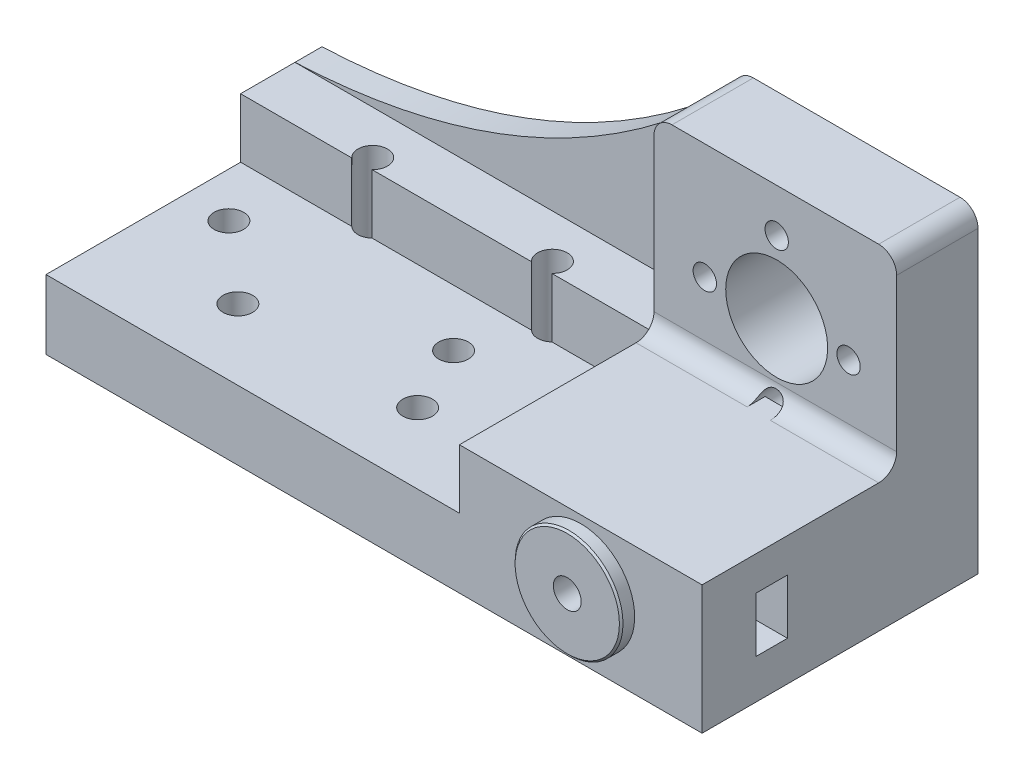
from build123d import *
from build123d.topology import SkipClean

# Parameters (mm, degrees)
CROQUIS2_R                  = 10.875
CROQUIS2_R_2                = 5.67
CROQUIS2_R_3                = 1.6
CROQUIS2_R_4                = 1.3
SALIENTE_EXTRUIR1_DEPTH     = 30.7
CROQUIS4_W                  = 27
CROQUIS4_H                  = 26
CORTAR_EXTRUIR2_DEPTH       = 22.7
CORTAR_EXTRUIR5_DEPTH       = 43
CROQUIS5_R                  = 1.65
CORTAR_EXTRUIR6_DEPTH       = 87.297233443
CORTAR_EXTRUIR7_REACH       = 88.297
CROQUIS7_W                  = 48
CROQUIS7_H                  = 15.35
CORTAR_EXTRUIR21_DEPTH      = 32.6
CORTAR_EXTRUIR9_DEPTH       = 3
CORTAR_EXTRUIR9_DEPTH_BACK  = 80.795378939
CORTAR_EXTRUIR10_DEPTH      = 80.795378939
CORTAR_EXTRUIR10_DEPTH_BACK = 80.795378939
CROQUIS11_3_R               = 1.65
CORTAR_EXTRUIR22_START      = -5
CROQUIS19_W                 = 6.3
CROQUIS19_H                 = 6.6
CORTAR_EXTRUIR22_DEPTH      = 5
CROQUIS20_R                 = 1.3
CROQUIS20_R_2               = 5.67
SALIENTE_EXTRUIR2_DEPTH     = 1.05
SALIENTE_EXTRUIR4_START     = -21.65
SALIENTE_EXTRUIR4_DEPTH     = 21.65
CROQUIS21_R                 = 1.55
CORTAR_EXTRUIR14_DEPTH      = 6
CORTAR_EXTRUIR15_START      = -6
CROQUIS21_4_R               = 1.55
CORTAR_EXTRUIR15_DEPTH      = 3.5
CORTAR_EXTRUIR16_START      = -12.5
CROQUIS21_5_R               = 1.55
CORTAR_EXTRUIR16_DEPTH      = 3
CROQUIS21_6_R               = 1.55
SALIENTE_EXTRUIR3_DEPTH     = 1.5
CHAFL_N1_SIZE               = 0.2
CROQUIS23_W                 = 75
CROQUIS23_H                 = 30.7
CORTAR_EXTRUIR17_DEPTH      = 11.7
CROQUIS25_W                 = 27
CROQUIS25_H                 = 9.05
CORTAR_EXTRUIR19_DEPTH      = 5
CORTAR_EXTRUIR20_DEPTH      = 2
SALIENTE_EXTRUIR5_DEPTH     = 3
REDONDEO1_START             = -1
REDONDEO1_DEPTH             = 11
REDONDEO2_START             = -13.65
REDONDEO2_DEPTH             = 12.349993706
REDONDEO2_START_2           = 1.300000703
REDONDEO2_2_DEPTH           = 12.049999297
REDONDEO2_START_3           = -1.300006294
REDONDEO2_3_DEPTH           = 2.600006997
REDONDEO2_START_4           = 9.05
REDONDEO2_4_DEPTH           = 2
REDONDEO3_R                 = 2


with BuildPart() as part:
    # Croquis2 → Saliente-Extruir1 (new body)
    # profile 1 of 6: a face of its own
    with BuildSketch(Plane.XY):
        Polygon((-61.65, 17.85), (-61.65, -34.15), (-50.65, -34.15), (-50.65, -32.65), (-50.65, -22.65), (-50.65, -22.45), (-49.65, -22.45), (-22.65, -22.45), (-21.65, -22.45), (-21.65, -22.65), (-21.65, -32.65), (-21.65, -34.15), (13.35, -34.15), (13.35, 17.85), align=None)
        Circle(CROQUIS2_R, mode=Mode.SUBTRACT)
    # profile 2 of 6: a face of its own
    with BuildSketch(Plane.XY):
        Circle(CROQUIS2_R)
        with Locations(Location((0, 0, 0), (0, 0, 90))):
            Circle(CROQUIS2_R_2, mode=Mode.SUBTRACT)
        with Locations((0, -8)):
            Circle(CROQUIS2_R_3, mode=Mode.SUBTRACT)
        with Locations((-8, 0)):
            Circle(CROQUIS2_R_3, mode=Mode.SUBTRACT)
        with Locations((8, 0)):
            Circle(CROQUIS2_R_3, mode=Mode.SUBTRACT)
        with Locations((0, 8)):
            Circle(CROQUIS2_R_3, mode=Mode.SUBTRACT)
    # profile 3 of 6: a face of its own
    with BuildSketch(Plane.XY):
        with Locations((0, 8)):
            Circle(CROQUIS2_R_3)
        with Locations(Location((0, 8, 0), (0, 0, 90))):
            Circle(CROQUIS2_R_4, mode=Mode.SUBTRACT)
    # profile 4 of 6: a face of its own
    with BuildSketch(Plane.XY):
        with Locations((8, 0)):
            Circle(CROQUIS2_R_3)
        with Locations(Location((8, 0, 0), (0, 0, 90))):
            Circle(CROQUIS2_R_4, mode=Mode.SUBTRACT)
    # profile 5 of 6: a face of its own
    with BuildSketch(Plane.XY):
        with Locations((0, -8)):
            Circle(CROQUIS2_R_3)
        with Locations(Location((0, -8, 0), (0, 0, 90))):
            Circle(CROQUIS2_R_4, mode=Mode.SUBTRACT)
    # profile 6 of 6: a face of its own
    with BuildSketch(Plane.XY):
        with Locations((-8, 0)):
            Circle(CROQUIS2_R_3)
        with Locations(Location((-8, 0, 0), (0, 0, 90))):
            Circle(CROQUIS2_R_4, mode=Mode.SUBTRACT)
    extrude(amount=SALIENTE_EXTRUIR1_DEPTH)

    # Croquis4 → Cortar-Extruir2 (cut)
    with BuildSketch(Plane.XY.offset(30.7)):
        with Locations((-0.15, 4.85)):
            Rectangle(CROQUIS4_W, CROQUIS4_H)
    extrude(amount=-CORTAR_EXTRUIR2_DEPTH, mode=Mode.SUBTRACT)

    # Croquis3 → Cortar-Extruir5 (cut)
    with BuildSketch(Plane.ZY.offset(61.65)):
        Polygon((9.05, -6.55), (9.05, -14.65), (9.05, -14.75), (9.25, -14.75), (21.45, -14.75), (21.65, -14.75), (21.65, -6.55), (21.45, -6.55), (9.25, -6.55), align=None)
    extrude(amount=-CORTAR_EXTRUIR5_DEPTH, mode=Mode.SUBTRACT)

    # Croquis5 → Cortar-Extruir6 (cut, through all)
    with BuildSketch(Plane(origin=(0, 17.85, 0), x_dir=(1, 0, 0), z_dir=(0, 1, 0))):
        with Locations(Location((-54.65, -15.35, 0), (0, 0, 270))):
            Circle(CROQUIS5_R)
        with Locations(Location((-29.65, -15.35, 0), (0, 0, 270))):
            Circle(CROQUIS5_R)
    extrude(amount=-CORTAR_EXTRUIR6_DEPTH, mode=Mode.SUBTRACT)

    # Cortar-Extruir7: up to this face of the body (flat: up to its plane)
    cortar_extruir7_end = Plane(part.part.faces().sort_by_distance((-7.470658579, -8.15, 19.35))[0])
    # Croquis7 → Cortar-Extruir7 (cut, up to the picked face)
    with BuildSketch(Plane(origin=(0, 17.85, 0), x_dir=(1, 0, 0), z_dir=(0, 1, 0)), mode=Mode.PRIVATE) as cortar_extruir7_sk1:
        with Locations((-37.65, -7.675)):
            Rectangle(CROQUIS7_W, CROQUIS7_H)
    cortar_extruir7_tool1 = split(extrude(cortar_extruir7_sk1.sketch, amount=-CORTAR_EXTRUIR7_REACH, mode=Mode.PRIVATE), bisect_by=cortar_extruir7_end, keep=Keep.BOTH, mode=Mode.PRIVATE)
    add(cortar_extruir7_tool1.solids().sort_by(Axis((-37.65, 17.85, 7.675), (0, -1, 0)))[0], mode=Mode.SUBTRACT)

    # Croquis7<4> → Cortar-Extruir21 (cut)
    with BuildSketch(Plane(origin=(0, 17.85, 0), x_dir=(1, 0, 0), z_dir=(0, 1, 0))):
        with BuildLine():
            Line((-61.65, -20.85), (-61.65, -30.7))
            Line((-61.65, -30.7), (-13.65, -30.7))
            Line((-13.65, -30.7), (-13.65, -20.85))
            Line((-13.65, -20.85), (-13.65, -15.35))
            Line((-13.65, -15.35), (-28, -15.35))
            ThreePointArc((-28, -15.35), (-29.65, -17), (-31.3, -15.35))
            Line((-31.3, -15.35), (-53, -15.35))
            ThreePointArc((-53, -15.35), (-54.65, -17), (-56.3, -15.35))
            Line((-56.3, -15.35), (-61.65, -15.35))
            Line((-61.65, -15.35), (-61.65, -20.85))
        make_face()
    extrude(amount=-CORTAR_EXTRUIR21_DEPTH, mode=Mode.SUBTRACT)

    # Croquis11 → Cortar-Extruir9 (cut, two sides: drawn at the far end of the back side and taken through both)
    with BuildSketch(Plane(origin=(0, -22.45, 0), x_dir=(1, 0, 0), z_dir=(0, 1, 0)).offset(-CORTAR_EXTRUIR9_DEPTH_BACK)):
        Polygon((-51.65, -13.617949192), (-54.65, -11.885898385), (-57.65, -13.617949192), (-57.65, -17.082050808), (-54.65, -18.814101615), (-51.65, -17.082050808), align=None)
        Polygon((-26.65, -13.617949192), (-29.65, -11.885898385), (-32.65, -13.617949192), (-32.65, -17.082050808), (-29.65, -18.814101615), (-26.65, -17.082050808), align=None)
    extrude(amount=CORTAR_EXTRUIR9_DEPTH + CORTAR_EXTRUIR9_DEPTH_BACK, mode=Mode.SUBTRACT)

    # Croquis11<3> → Cortar-Extruir10 (cut, two sides: drawn at the far end of the back side and taken through both)
    with BuildSketch(Plane(origin=(0, -22.45, 0), x_dir=(1, 0, 0), z_dir=(0, 1, 0)).offset(-CORTAR_EXTRUIR10_DEPTH_BACK)):
        with Locations(Location((-46.15, -7.85, 0), (0, 0, 270))):
            Circle(CROQUIS11_3_R)
        with Locations(Location((-26.15, -7.85, 0), (0, 0, 270))):
            Circle(CROQUIS11_3_R)
        with Locations(Location((-26.15, -22.849986467, 0), (0, 0, 270))):
            Circle(CROQUIS11_3_R)
        with Locations(Location((-46.15, -22.849986467, 0), (0, 0, 270))):
            Circle(CROQUIS11_3_R)
    extrude(amount=CORTAR_EXTRUIR10_DEPTH + CORTAR_EXTRUIR10_DEPTH_BACK, mode=Mode.SUBTRACT)

    # Croquis19 → Cortar-Extruir22 (cut)
    with BuildSketch(Plane.ZY.offset(18.65).offset(CORTAR_EXTRUIR22_START)):
        with Locations((12.2, -11.45)):
            Rectangle(CROQUIS19_W, CROQUIS19_H)
    extrude(amount=CORTAR_EXTRUIR22_DEPTH, mode=Mode.SUBTRACT)

    # Croquis20 → Saliente-Extruir2 (add)
    with SkipClean():  # the faces are left unmerged after this step: merging them gives an invalid solid
        with BuildSketch(Plane.XY.offset(8)):
            with BuildLine():
                Line((-13.65, -8.15), (-1.291317157, -8.15))
                ThreePointArc((-1.291317157, -8.15), (0, -6.7), (1.291317157, -8.15))
                Line((1.291317157, -8.15), (13.35, -8.15))
                Line((13.35, -8.15), (13.35, 17.85))
                Line((13.35, 17.85), (-13.65, 17.85))
                Line((-13.65, 17.85), (-13.65, -8.15))
            make_face()
            with Locations(Location((-8, 0, 0), (0, 0, 180))):
                Circle(CROQUIS20_R, mode=Mode.SUBTRACT)
            with Locations(Location((8, 0, 0), (0, 0, 180))):
                Circle(CROQUIS20_R, mode=Mode.SUBTRACT)
            with Locations(Location((0, 8, 0), (0, 0, 180))):
                Circle(CROQUIS20_R, mode=Mode.SUBTRACT)
            with Locations(Location((0, 0, 0), (0, 0, 180))):
                Circle(CROQUIS20_R_2, mode=Mode.SUBTRACT)
        extrude(amount=SALIENTE_EXTRUIR2_DEPTH)

    # Croquis22 → Saliente-Extruir4 (add)
    with BuildSketch(Plane.XY.offset(30.7).offset(SALIENTE_EXTRUIR4_START)):
        with BuildLine():
            Line((-1.291317157, -8.15), (1.291317157, -8.15))
            ThreePointArc((1.291317157, -8.15), (0, -9.3), (-1.291317157, -8.15))
        make_face()
    extrude(amount=SALIENTE_EXTRUIR4_DEPTH)

    # Croquis21 → Cortar-Extruir14 (cut)
    with BuildSketch(Plane.XY.offset(30.7)):
        with Locations((-0.15, -15)):
            Circle(CROQUIS21_R)
    extrude(amount=-CORTAR_EXTRUIR14_DEPTH, mode=Mode.SUBTRACT)

    # Croquis21<4> → Cortar-Extruir15 (cut)
    # profile 1 of 4: a face of its own
    with BuildSketch(Plane.XY.offset(30.7).offset(CORTAR_EXTRUIR15_START)):
        Polygon((3.371836642, -15), (1.610918321, -11.95), (-1.910918321, -11.95), (-3.671836642, -15), (-1.910918321, -18.05), (1.610918321, -18.05), align=None)
        with Locations((-0.15, -15)):
            Circle(CROQUIS21_4_R, mode=Mode.SUBTRACT)
    # profile 2 of 4: a face of its own
    with BuildSketch(Plane.XY.offset(30.7).offset(CORTAR_EXTRUIR15_START)):
        with Locations((-0.15, -15)):
            Circle(CROQUIS21_4_R)
    # profile 3 of 4: a face of its own
    with BuildSketch(Plane.XY.offset(30.7).offset(CORTAR_EXTRUIR15_START)):
        with BuildLine():
            Line((13.35, -11.95), (5.016962357, -11.95))
            ThreePointArc((5.016962357, -11.95), (5.637995082, -13.419141711), (5.85, -15))
            ThreePointArc((5.85, -15), (5.637995082, -16.580858289), (5.016962357, -18.05))
            Line((5.016962357, -18.05), (13.35, -18.05))
            Line((13.35, -18.05), (13.35, -11.95))
        make_face()
    # profile 4 of 4: a face of its own
    with BuildSketch(Plane.XY.offset(30.7).offset(CORTAR_EXTRUIR15_START)):
        with BuildLine():
            Line((5.016962357, -11.95), (1.610918321, -11.95))
            Line((1.610918321, -11.95), (3.371836642, -15))
            Line((3.371836642, -15), (1.610918321, -18.05))
            Line((1.610918321, -18.05), (5.016962357, -18.05))
            ThreePointArc((5.016962357, -18.05), (5.637995082, -16.580858289), (5.85, -15))
            ThreePointArc((5.85, -15), (5.637995082, -13.419141711), (5.016962357, -11.95))
        make_face()
    extrude(amount=-CORTAR_EXTRUIR15_DEPTH, mode=Mode.SUBTRACT)

    # Croquis21<5> → Cortar-Extruir16 (cut)
    with BuildSketch(Plane.XY.offset(30.7).offset(CORTAR_EXTRUIR16_START)):
        with Locations((-0.15, -15)):
            Circle(CROQUIS21_5_R)
    extrude(amount=CORTAR_EXTRUIR16_DEPTH, mode=Mode.SUBTRACT)

    # Croquis21<6> → Saliente-Extruir3 (add)
    # profile 1 of 3: a face of its own
    with BuildSketch(Plane.XY.offset(30.7)):
        with BuildLine():
            Line((-1.910918321, -11.95), (1.610918321, -11.95))
            Line((1.610918321, -11.95), (5.016962357, -11.95))
            ThreePointArc((5.016962357, -11.95), (-6.15, -15), (5.016962357, -18.05))
            Line((5.016962357, -18.05), (1.610918321, -18.05))
            Line((1.610918321, -18.05), (-1.910918321, -18.05))
            Line((-1.910918321, -18.05), (-3.671836642, -15))
            Line((-3.671836642, -15), (-1.910918321, -11.95))
        make_face()
    # profile 2 of 3: a face of its own
    with BuildSketch(Plane.XY.offset(30.7)):
        with BuildLine():
            Line((5.016962357, -11.95), (1.610918321, -11.95))
            Line((1.610918321, -11.95), (3.371836642, -15))
            Line((3.371836642, -15), (1.610918321, -18.05))
            Line((1.610918321, -18.05), (5.016962357, -18.05))
            ThreePointArc((5.016962357, -18.05), (5.637995082, -16.580858289), (5.85, -15))
            ThreePointArc((5.85, -15), (5.637995082, -13.419141711), (5.016962357, -11.95))
        make_face()
    # profile 3 of 3: a face of its own
    with BuildSketch(Plane.XY.offset(30.7)):
        Polygon((3.371836642, -15), (1.610918321, -11.95), (-1.910918321, -11.95), (-3.671836642, -15), (-1.910918321, -18.05), (1.610918321, -18.05), align=None)
        with Locations((-0.15, -15)):
            Circle(CROQUIS21_6_R, mode=Mode.SUBTRACT)
    extrude(amount=SALIENTE_EXTRUIR3_DEPTH)

    # Chaflán1
    chafl_n1_edges = [part.edges().sort_by_distance(p)[0] for p in [
        (-5.316962357, -11.95, 32.2),
    ]]
    chamfer(chafl_n1_edges, length=CHAFL_N1_SIZE)

    # Croquis23 → Cortar-Extruir17 (cut)
    with BuildSketch(Plane.XZ.offset(34.15)):
        with Locations((-24.15, 15.35)):
            Rectangle(CROQUIS23_W, CROQUIS23_H)
    extrude(amount=-CORTAR_EXTRUIR17_DEPTH, mode=Mode.SUBTRACT)

    # Croquis25 → Cortar-Extruir19 (cut)
    with BuildSketch(Plane(origin=(0, 17.85, 0), x_dir=(1, 0, 0), z_dir=(0, 1, 0))):
        with Locations((-0.15, -4.525)):
            Rectangle(CROQUIS25_W, CROQUIS25_H)
    extrude(amount=-CORTAR_EXTRUIR19_DEPTH, mode=Mode.SUBTRACT)

    # Croquis26 → Cortar-Extruir20 (cut)
    with BuildSketch(Plane.ZY.offset(61.65)):
        Polygon((0, -22.45), (30.7, -22.45), (30.7, -14.75), (9.05, -14.75), (9.05, -8.15), (0, -8.15), align=None)
    extrude(amount=-CORTAR_EXTRUIR20_DEPTH, mode=Mode.SUBTRACT)

    # Croquis27 → Saliente-Extruir5 (add)
    with BuildSketch(Plane(origin=(0, 0, 0), x_dir=(-1, 0, 0), z_dir=(0, 0, -1))):
        with BuildLine():
            Line((13.65, -8.15), (13.65, 10.85))
            add(Edge.make_bspline(
                [(13.65, 10.85), (32.891497734, -6.974521578), (59.65, -8.15)],
                knots=[0, 0, 0, 1, 1, 1], degree=2))
            Line((59.65, -8.15), (13.65, -8.15))
        make_face()
    extrude(amount=-SALIENTE_EXTRUIR5_DEPTH)

    # Redondeo1: read off the stored shape, not the designer's step
    # Redondeo1 outline → Redondeo1 (cut)
    with BuildSketch(Plane.XY.offset(REDONDEO1_START)):
        with BuildLine():
            ThreePointArc((-13.65, 10.85), (-13.064213562, 12.264213562), (-11.65, 12.85))
            Line((-11.65, 12.85), (-13.65, 12.85))
            Line((-13.65, 12.85), (-13.65, 10.85))
        make_face()
        with BuildLine():
            ThreePointArc((11.35, 12.85), (12.764213562, 12.264213562), (13.35, 10.85))
            Line((13.35, 10.85), (13.35, 12.85))
            Line((13.35, 12.85), (11.35, 12.85))
        make_face()
    extrude(amount=REDONDEO1_DEPTH, mode=Mode.SUBTRACT)

    # Redondeo2: read off the stored shape, not the designer's step
    # Redondeo2 outline → Redondeo2 (add)
    with BuildSketch(Plane.YZ.offset(REDONDEO2_START)):
        with BuildLine():
            ThreePointArc((-6.15, 9.05), (-7.564213562, 9.635786438), (-8.15, 11.05))
            Line((-8.15, 11.05), (-8.15, 9.05))
            Line((-8.15, 9.05), (-6.15, 9.05))
        make_face()
    extrude(amount=REDONDEO2_DEPTH)

    # Redondeo2 2 outline → Redondeo2 2 (add)
    with BuildSketch(Plane.YZ.offset(REDONDEO2_START_2)):
        with BuildLine():
            ThreePointArc((-6.15, 9.05), (-7.564213562, 9.635786438), (-8.15, 11.05))
            Line((-8.15, 11.05), (-8.15, 9.05))
            Line((-8.15, 9.05), (-6.15, 9.05))
        make_face()
    extrude(amount=REDONDEO2_2_DEPTH)

    # Redondeo2 3 outline → Redondeo2 3 (add)
    with BuildSketch(Plane.YZ.offset(REDONDEO2_START_3)):
        with BuildLine():
            ThreePointArc((-6.15, 9.05), (-7.564213562, 9.635786438), (-8.15, 11.05))
            Line((-8.15, 11.05), (-8.15, 9.05))
            Line((-8.15, 9.05), (-6.15, 9.05))
        make_face()
    extrude(amount=REDONDEO2_3_DEPTH)

    # Redondeo2 4 outline → Redondeo2 4 (cut)
    with BuildSketch(Plane.XY.offset(REDONDEO2_START_4)):
        with BuildLine():
            ThreePointArc((1.291317157, -8.15), (0, -6.7), (-1.291317157, -8.15))
            Line((-1.291317157, -8.15), (1.291317157, -8.15))
        make_face()
    extrude(amount=REDONDEO2_4_DEPTH, mode=Mode.SUBTRACT)

    # Redondeo3
    # the kernel refuses this fillet: 2 mm, written as the material it adds along each edge
    with BuildSketch(Plane(origin=(-13.65, 10.85, 0), x_dir=(-0.7366744354008804, -0.6762475702187728, 0), z_dir=(0, 0, 1))) as redondeo3_piece_1:
        with BuildLine():
            CenterArc((0.708603199, -1.999979343), REDONDEO3_R, 89.739590275, 33.318429066)
            ThreePointArc((-0.382372835, -0.323742101), (-0.181008825, -0.173891837), (0, 0))
            ThreePointArc((0, 0), (0.358846588, 0.000814265), (0.717693182, 0))
        make_face()
    extrude(amount=3)


solid = part.part
